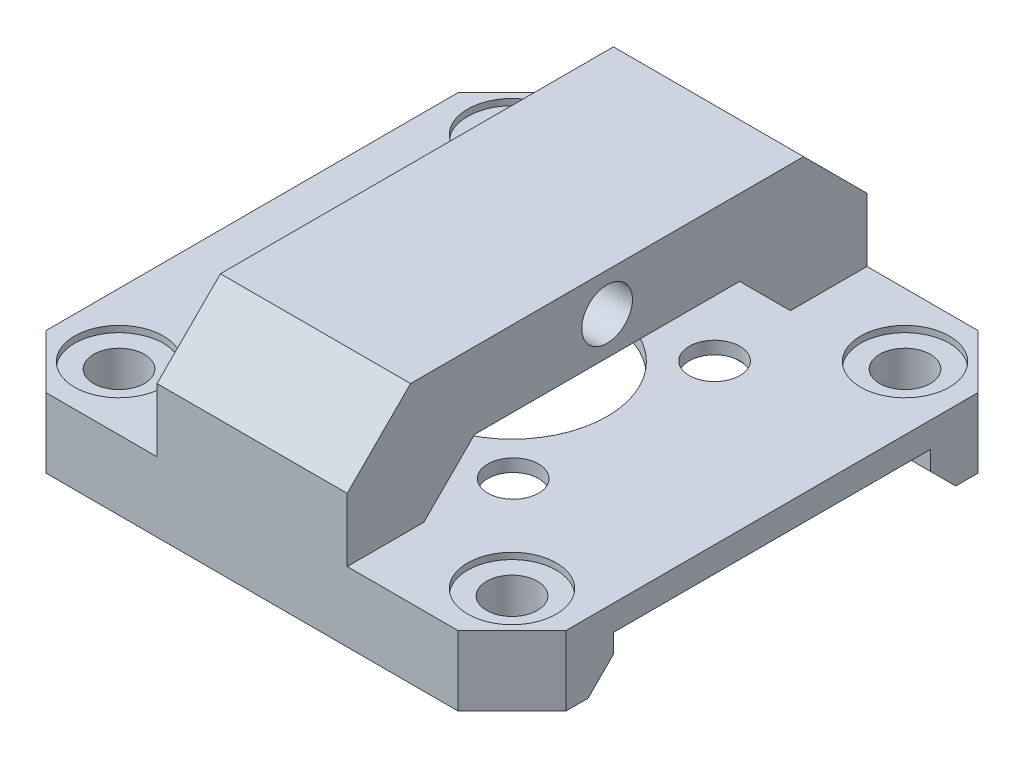
from build123d import *

# Parameters (mm, degrees)
SKETCH2_W           = 41
SKETCH2_H           = 41
BOSS_EXTRUDE1_DEPTH = 2
SKETCH3_R           = 2
CUT_EXTRUDE1_DEPTH  = 30.060282173
SKETCH4_R           = 7.5
CUT_EXTRUDE2_DEPTH  = 30.060282173
SKETCH5_W           = 25
SKETCH5_H           = 25
CUT_EXTRUDE3_DEPTH  = 1
CUT_EXTRUDE4_DEPTH  = 30.060282173
SKETCH7_R           = 2
CUT_EXTRUDE5_DEPTH  = 30.060282173
SKETCH8_W           = 25
SKETCH8_H           = 8
SKETCH8_H_2         = 7.957817611
BOSS_EXTRUDE2_DEPTH = 3.5
SKETCH9_R           = 2
CUT_EXTRUDE6_DEPTH  = 30.508473359
BOSS_EXTRUDE3_START = 3.5
SKETCH10_R          = 2
BOSS_EXTRUDE3_DEPTH = 3.5
SKETCH11_R          = 3.5
CUT_EXTRUDE7_DEPTH  = 3.5
SKETCH12_W          = 8
SKETCH12_H          = 2
BOSS_EXTRUDE4_DEPTH = 3.5
SKETCH13_R          = 3.5
CUT_EXTRUDE8_DEPTH  = 3.5
SKETCH14_R          = 3.5
SKETCH14_R_2        = 2
BOSS_EXTRUDE5_DEPTH = 3
SKETCH15_W          = 15
SKETCH15_H          = 8.042182389
SKETCH15_R          = 2
SKETCH15_H_2        = 8
BOSS_EXTRUDE6_DEPTH = 4
SKETCH16_W          = 8
SKETCH16_H          = 25
CUT_EXTRUDE9_DEPTH  = 3.5
CHAMFER3_SIZE       = 2
CHAMFER4_SIZE       = 2
SKETCH17_R          = 2
BOSS_EXTRUDE7_DEPTH = 9.5
SKETCH21_W          = 15
SKETCH21_H          = 30.915635222
CUT_EXTRUDE11_DEPTH = 4
SKETCH18_W          = 15
SKETCH18_H          = 41
BOSS_EXTRUDE8_DEPTH = 6
CHAMFER5_SIZE       = 5
SKETCH22_R          = 2
CUT_EXTRUDE12_DEPTH = 4


with BuildPart() as part:
    # Sketch2 → Boss-Extrude1 (new body)
    with BuildSketch(Plane(origin=(0, 0, 0), x_dir=(1, 0, 0), z_dir=(0, 1, 0))):
        Rectangle(SKETCH2_W, SKETCH2_H)
    extrude(amount=BOSS_EXTRUDE1_DEPTH)

    # Sketch3 → Cut-Extrude1 (cut, through all)
    with BuildSketch(Plane.XZ):
        with Locations(Location((-7.943181907, 8.037155044, 0), (0, 0, 270))):
            Circle(SKETCH3_R)
        with Locations(Location((8.037155044, 7.943181907, 0), (0, 0, 270))):
            Circle(SKETCH3_R)
        with Locations(Location((7.943181907, -8.037155044, 0), (0, 0, 270))):
            Circle(SKETCH3_R)
        with Locations(Location((-8.037155044, -7.943181907, 0), (0, 0, 270))):
            Circle(SKETCH3_R)
    extrude(amount=-CUT_EXTRUDE1_DEPTH, mode=Mode.SUBTRACT)

    # Sketch4 → Cut-Extrude2 (cut, through all)
    with BuildSketch(Plane(origin=(0, 2, 0), x_dir=(1, 0, 0), z_dir=(0, 1, 0))):
        with Locations(Location((0, 0, 0), (0, 0, 270))):
            Circle(SKETCH4_R)
    extrude(amount=-CUT_EXTRUDE2_DEPTH, mode=Mode.SUBTRACT)

    # Sketch5 → Cut-Extrude3 (cut)
    with BuildSketch(Plane.XZ):
        Rectangle(SKETCH5_W, SKETCH5_H)
    extrude(amount=-CUT_EXTRUDE3_DEPTH, mode=Mode.SUBTRACT)

    # Sketch6 → Cut-Extrude4 (cut, through all)
    with BuildSketch(Plane(origin=(0, 2, 0), x_dir=(1, 0, 0), z_dir=(0, 1, 0))):
        Polygon((-20.5, 16.257359313), (-16.257359313, 20.5), (-20.5, 20.5), align=None)
        Polygon((16.257359313, 20.5), (20.5, 16.257359313), (20.5, 20.5), align=None)
        Polygon((20.5, -16.257359313), (16.257359313, -20.5), (20.5, -20.5), align=None)
        Polygon((-16.257359313, -20.5), (-20.5, -16.257359313), (-20.5, -20.5), align=None)
    extrude(amount=-CUT_EXTRUDE4_DEPTH, mode=Mode.SUBTRACT)

    # Sketch7 → Cut-Extrude5 (cut, through all)
    with BuildSketch(Plane.XZ):
        with Locations(Location((-15.5, 15.5, 0), (0, 0, 270))):
            Circle(SKETCH7_R)
        with Locations(Location((15.5, 15.5, 0), (0, 0, 270))):
            Circle(SKETCH7_R)
        with Locations(Location((15.5, -15.5, 0), (0, 0, 270))):
            Circle(SKETCH7_R)
        with Locations(Location((-15.5, -15.5, 0), (0, 0, 270))):
            Circle(SKETCH7_R)
    extrude(amount=-CUT_EXTRUDE5_DEPTH, mode=Mode.SUBTRACT)

    # Sketch8 → Boss-Extrude2 (add)
    with BuildSketch(Plane.XZ):
        with Locations((0, 16.5)):
            Rectangle(SKETCH8_W, SKETCH8_H)
        with Locations((0, -16.478908806)):
            Rectangle(SKETCH8_W, SKETCH8_H_2)
    extrude(amount=BOSS_EXTRUDE2_DEPTH)

    # Sketch9 → Cut-Extrude6 (cut, through all)
    with BuildSketch(Plane.XZ.offset(3.5)):
        with Locations(Location((0, 16.5, 0), (0, 0, 270))):
            Circle(SKETCH9_R)
        with Locations(Location((0, -16.478908806, 0), (0, 0, 270))):
            Circle(SKETCH9_R)
    extrude(amount=-CUT_EXTRUDE6_DEPTH, mode=Mode.SUBTRACT)

    # Sketch10 → Boss-Extrude3 (add)
    # profile 1 of 3: a face of its own
    with BuildSketch(Plane.XZ.offset(BOSS_EXTRUDE3_START)):
        Polygon((-20.5, 16.257359313), (-20.5, 12.5), (-12.5, 12.5), (-12.5, 20.5), (-16.257359313, 20.5), align=None)
        with Locations(Location((-15.5, 15.5, 0), (0, 0, 270))):
            Circle(SKETCH10_R, mode=Mode.SUBTRACT)
    # profile 2 of 3: a face of its own
    with BuildSketch(Plane.XZ.offset(BOSS_EXTRUDE3_START)):
        Polygon((12.5, 12.5), (20.5, 12.5), (20.5, 16.257359313), (16.257359313, 20.5), (12.5, 20.5), align=None)
        with Locations(Location((15.5, 15.5, 0), (0, 0, 270))):
            Circle(SKETCH10_R, mode=Mode.SUBTRACT)
    # profile 3 of 3: a face of its own
    with BuildSketch(Plane.XZ.offset(BOSS_EXTRUDE3_START)):
        Polygon((-20.5, -12.5), (-20.5, -16.257359313), (-16.257359313, -20.5), (16.257359313, -20.5), (20.5, -16.257359313), (20.5, -12.5), (12.5, -12.5), (12.5, -20.457817611), (-12.5, -20.457817611), (-12.5, -12.5), align=None)
        with Locations(Location((-15.5, -15.5, 0), (0, 0, 270))):
            Circle(SKETCH10_R, mode=Mode.SUBTRACT)
        with Locations(Location((15.5, -15.5, 0), (0, 0, 270))):
            Circle(SKETCH10_R, mode=Mode.SUBTRACT)
    extrude(amount=-BOSS_EXTRUDE3_DEPTH)

    # Sketch11 → Cut-Extrude7 (cut)
    with BuildSketch(Plane(origin=(0, 2, 0), x_dir=(1, 0, 0), z_dir=(0, 1, 0))):
        with Locations(Location((-15.5, 15.5, 0), (0, 0, 270))):
            Circle(SKETCH11_R)
        with Locations(Location((15.5, 15.5, 0), (0, 0, 270))):
            Circle(SKETCH11_R)
        with Locations(Location((15.5, -15.5, 0), (0, 0, 270))):
            Circle(SKETCH11_R)
        with Locations(Location((-15.5, -15.5, 0), (0, 0, 270))):
            Circle(SKETCH11_R)
    extrude(amount=-CUT_EXTRUDE7_DEPTH, mode=Mode.SUBTRACT)

    # Sketch12 → Boss-Extrude4 (add)
    with BuildSketch(Plane.XZ):
        with Locations((-16.5, -11.5)):
            Rectangle(SKETCH12_W, SKETCH12_H)
        with Locations((-16.5, 11.5)):
            Rectangle(SKETCH12_W, SKETCH12_H)
        with Locations((16.5, -11.5)):
            Rectangle(SKETCH12_W, SKETCH12_H)
        with Locations((16.5, 11.5)):
            Rectangle(SKETCH12_W, SKETCH12_H)
    extrude(amount=BOSS_EXTRUDE4_DEPTH)

    # Sketch13 → Cut-Extrude8 (cut)
    with BuildSketch(Plane(origin=(0, 2, 0), x_dir=(1, 0, 0), z_dir=(0, 1, 0))):
        with Locations(Location((-15.5, 15.5, 0), (0, 0, 270))):
            Circle(SKETCH13_R)
        with Locations(Location((15.5, 15.5, 0), (0, 0, 270))):
            Circle(SKETCH13_R)
        with Locations(Location((15.5, -15.5, 0), (0, 0, 270))):
            Circle(SKETCH13_R)
        with Locations(Location((-15.5, -15.5, 0), (0, 0, 270))):
            Circle(SKETCH13_R)
    extrude(amount=-CUT_EXTRUDE8_DEPTH, mode=Mode.SUBTRACT)

    # Sketch14 → Boss-Extrude5 (add)
    # profile 1 of 4: a face of its own
    with BuildSketch(Plane(origin=(0, -1.5, 0), x_dir=(1, 0, 0), z_dir=(0, 1, 0))):
        with Locations(Location((-15.5, -15.5, 0), (0, 0, 270))):
            Circle(SKETCH14_R)
        with Locations(Location((-15.5, -15.5, 0), (0, 0, 90))):
            Circle(SKETCH14_R_2, mode=Mode.SUBTRACT)
    # profile 2 of 4: a face of its own
    with BuildSketch(Plane(origin=(0, -1.5, 0), x_dir=(1, 0, 0), z_dir=(0, 1, 0))):
        with Locations(Location((-15.5, 15.5, 0), (0, 0, 270))):
            Circle(SKETCH14_R)
        with Locations(Location((-15.5, 15.5, 0), (0, 0, 90))):
            Circle(SKETCH14_R_2, mode=Mode.SUBTRACT)
    # profile 3 of 4: a face of its own
    with BuildSketch(Plane(origin=(0, -1.5, 0), x_dir=(1, 0, 0), z_dir=(0, 1, 0))):
        with Locations(Location((15.5, 15.5, 0), (0, 0, 270))):
            Circle(SKETCH14_R)
        with Locations(Location((15.5, 15.5, 0), (0, 0, 90))):
            Circle(SKETCH14_R_2, mode=Mode.SUBTRACT)
    # profile 4 of 4: a face of its own
    with BuildSketch(Plane(origin=(0, -1.5, 0), x_dir=(1, 0, 0), z_dir=(0, 1, 0))):
        with Locations(Location((15.5, -15.5, 0), (0, 0, 270))):
            Circle(SKETCH14_R)
        with Locations(Location((15.5, -15.5, 0), (0, 0, 90))):
            Circle(SKETCH14_R_2, mode=Mode.SUBTRACT)
    extrude(amount=BOSS_EXTRUDE5_DEPTH)

    # Sketch15 → Boss-Extrude6 (add)
    # profile 1 of 2: a face of its own
    with BuildSketch(Plane(origin=(0, 2, 0), x_dir=(1, 0, 0), z_dir=(0, 1, 0))):
        with Locations((0, 16.478908806)):
            Rectangle(SKETCH15_W, SKETCH15_H)
        with Locations(Location((0, 16.478908806, 0), (0, 0, 90))):
            Circle(SKETCH15_R, mode=Mode.SUBTRACT)
    # profile 2 of 2: a face of its own
    with BuildSketch(Plane(origin=(0, 2, 0), x_dir=(1, 0, 0), z_dir=(0, 1, 0))):
        with Locations((0, -16.5)):
            Rectangle(SKETCH15_W, SKETCH15_H_2)
        with Locations(Location((0, -16.478908806, 0), (0, 0, 90))):
            Circle(SKETCH15_R, mode=Mode.SUBTRACT)
    extrude(amount=BOSS_EXTRUDE6_DEPTH)

    # Sketch16 → Cut-Extrude9 (cut)
    with BuildSketch(Plane.XZ.offset(3.5)):
        with Locations((-16.5, 0)):
            Rectangle(SKETCH16_W, SKETCH16_H)
        with Locations((16.5, 0)):
            Rectangle(SKETCH16_W, SKETCH16_H)
    extrude(amount=-CUT_EXTRUDE9_DEPTH, mode=Mode.SUBTRACT)

    # Chamfer3
    # the kernel refuses this chamfer: 2 mm, written as the material it takes off along each edge
    with BuildSketch(Plane(origin=(-25.643365976, -3.5, 12.5), x_dir=(0, -0.02749587661058627, 0.9996219169112968), z_dir=(1, 0, 0))) as chamfer3_piece_1:
        Polygon((CHAMFER3_SIZE * 0.999621916911, -CHAMFER3_SIZE * 0.0274958766106), (-CHAMFER3_SIZE * 0.0274958766106, -CHAMFER3_SIZE * 0.999621916911), (0, 0), align=None)
    extrude(amount=51.286731952, mode=Mode.SUBTRACT)
    with BuildSketch(Plane(origin=(12.5, -3.5, -12.5), x_dir=(0, -0.02749587661058627, -0.9996219169112968), z_dir=(-1, 0, 0))) as chamfer3_piece_2:
        Polygon((CHAMFER3_SIZE * 0.999621916911, -CHAMFER3_SIZE * 0.0274958766106), (-CHAMFER3_SIZE * 0.0274958766106, -CHAMFER3_SIZE * 0.999621916911), (0, 0), align=None)
    extrude(amount=25, mode=Mode.SUBTRACT)
    with BuildSketch(Plane(origin=(25.643365976, -3.5, -12.5), x_dir=(0, 0.9996219169112968, 0.027495876610586487), z_dir=(-1, 0, 0))) as chamfer3_piece_3:
        Polygon((CHAMFER3_SIZE * 0.999621916911, CHAMFER3_SIZE * 0.0274958766106), (-CHAMFER3_SIZE * 0.0274958766106, CHAMFER3_SIZE * 0.999621916911), (0, 0), align=None)
    extrude(amount=13.143365976, mode=Mode.SUBTRACT)
    with BuildSketch(Plane(origin=(-12.5, -3.5, -12.5), x_dir=(0, -0.02749587661058627, -0.9996219169112968), z_dir=(-1, 0, 0))) as chamfer3_piece_4:
        Polygon((CHAMFER3_SIZE * 0.999621916911, -CHAMFER3_SIZE * 0.0274958766106), (-CHAMFER3_SIZE * 0.0274958766106, -CHAMFER3_SIZE * 0.999621916911), (0, 0), align=None)
    extrude(amount=13.143365976, mode=Mode.SUBTRACT)

    # Chamfer4
    # the kernel refuses this chamfer: 2 mm, written as the material it takes off along each edge
    with BuildSketch(Plane(origin=(12.5, 0, -10.5), x_dir=(0.9996219169112968, -0.027495876610586365, 0), z_dir=(0, 0, 1))) as chamfer4_piece_1_section:
        Polygon((CHAMFER4_SIZE * 0.999621916911, CHAMFER4_SIZE * 0.0274958766106), (-CHAMFER4_SIZE * 0.0274958766106, CHAMFER4_SIZE * 0.999621916911), (0, 0), align=None)
    chamfer4_piece_1 = extrude(amount=21, mode=Mode.PRIVATE)
    chamfer4_piece_1 = split(chamfer4_piece_1, bisect_by=Plane(origin=(13.277777778, 1, 0), z_dir=(0, -1, 0)), keep=Keep.TOP, mode=Mode.PRIVATE)
    add(chamfer4_piece_1, mode=Mode.SUBTRACT)
    with BuildSketch(Plane(origin=(-12.5, 0, 10.5), x_dir=(-0.9996219169112968, -0.027495876610586365, 0), z_dir=(0, 0, -1))) as chamfer4_piece_2_section:
        Polygon((CHAMFER4_SIZE * 0.999621916911, CHAMFER4_SIZE * 0.0274958766106), (-CHAMFER4_SIZE * 0.0274958766106, CHAMFER4_SIZE * 0.999621916911), (0, 0), align=None)
    chamfer4_piece_2 = extrude(amount=21, mode=Mode.PRIVATE)
    chamfer4_piece_2 = split(chamfer4_piece_2, bisect_by=Plane(origin=(-13.277777778, 1, 0), z_dir=(0, -1, 0)), keep=Keep.TOP, mode=Mode.PRIVATE)
    add(chamfer4_piece_2, mode=Mode.SUBTRACT)
    with BuildSketch(Plane(origin=(-12.5, 0, 12.5), x_dir=(-0.9996219169112968, -0.027495876610586365, 0), z_dir=(0, 0, -1))) as chamfer4_piece_3_section:
        Polygon((CHAMFER4_SIZE * 0.999621916911, CHAMFER4_SIZE * 0.0274958766106), (-CHAMFER4_SIZE * 0.0274958766106, CHAMFER4_SIZE * 0.999621916911), (0, 0), align=None)
    chamfer4_piece_3 = extrude(amount=2, mode=Mode.PRIVATE)
    chamfer4_piece_3 = split(chamfer4_piece_3, bisect_by=Plane(origin=(-14.086266388, 1, 12.40211723), z_dir=(0, -1, 0)), keep=Keep.TOP, mode=Mode.PRIVATE)
    add(chamfer4_piece_3, mode=Mode.SUBTRACT)
    with BuildSketch(Plane(origin=(-12.5, 0, -10.5), x_dir=(-0.9996219169112968, -0.027495876610586365, 0), z_dir=(0, 0, -1))) as chamfer4_piece_4_section:
        Polygon((CHAMFER4_SIZE * 0.999621916911, CHAMFER4_SIZE * 0.0274958766106), (-CHAMFER4_SIZE * 0.0274958766106, CHAMFER4_SIZE * 0.999621916911), (0, 0), align=None)
    chamfer4_piece_4 = extrude(amount=2, mode=Mode.PRIVATE)
    chamfer4_piece_4 = split(chamfer4_piece_4, bisect_by=Plane(origin=(-13.265579252, 1, -11.486388799), z_dir=(0, -1, 0)), keep=Keep.TOP, mode=Mode.PRIVATE)
    add(chamfer4_piece_4, mode=Mode.SUBTRACT)
    with BuildSketch(Plane(origin=(12.5, 0, -12.5), x_dir=(0.9996219169112968, -0.02749587661058633, 0), z_dir=(0, 0, 1))) as chamfer4_piece_5_section:
        Polygon((CHAMFER4_SIZE * 0.999621916911, CHAMFER4_SIZE * 0.0274958766106), (-CHAMFER4_SIZE * 0.0274958766106, CHAMFER4_SIZE * 0.999621916911), (0, 0), align=None)
    chamfer4_piece_5 = extrude(amount=2, mode=Mode.PRIVATE)
    chamfer4_piece_5 = split(chamfer4_piece_5, bisect_by=Plane(origin=(14.086266388, 1, -12.40211723), z_dir=(0, -1, 0)), keep=Keep.TOP, mode=Mode.PRIVATE)
    add(chamfer4_piece_5, mode=Mode.SUBTRACT)
    with BuildSketch(Plane(origin=(12.5, 0, 10.5), x_dir=(0.9996219169112968, -0.027495876610586344, 0), z_dir=(0, 0, 1))) as chamfer4_piece_6_section:
        Polygon((CHAMFER4_SIZE * 0.999621916911, CHAMFER4_SIZE * 0.0274958766106), (-CHAMFER4_SIZE * 0.0274958766106, CHAMFER4_SIZE * 0.999621916911), (0, 0), align=None)
    chamfer4_piece_6 = extrude(amount=2, mode=Mode.PRIVATE)
    chamfer4_piece_6 = split(chamfer4_piece_6, bisect_by=Plane(origin=(13.265579252, 1, 11.486388799), z_dir=(0, -1, 0)), keep=Keep.TOP, mode=Mode.PRIVATE)
    add(chamfer4_piece_6, mode=Mode.SUBTRACT)

    # Sketch17 → Boss-Extrude7 (add, through all)
    with BuildSketch(Plane(origin=(0, 6, 0), x_dir=(1, 0, 0), z_dir=(0, 1, 0))):
        with Locations((0, 16.478908806)):
            Circle(SKETCH17_R)
        with Locations((0, -16.478908806)):
            Circle(SKETCH17_R)
    extrude(amount=-BOSS_EXTRUDE7_DEPTH)

    # Sketch21 → Cut-Extrude11 (cut)
    with BuildSketch(Plane(origin=(0, 6, 0), x_dir=(1, 0, 0), z_dir=(0, 1, 0))):
        Rectangle(SKETCH21_W, SKETCH21_H)
    extrude(amount=-CUT_EXTRUDE11_DEPTH, mode=Mode.SUBTRACT)

    # Sketch18 → Boss-Extrude8 (add)
    with BuildSketch(Plane(origin=(0, 6, 0), x_dir=(1, 0, 0), z_dir=(0, 1, 0))):
        Rectangle(SKETCH18_W, SKETCH18_H)
    extrude(amount=BOSS_EXTRUDE8_DEPTH)

    # Chamfer5
    # the kernel refuses this chamfer: 5 mm, written as the material it adds along each edge
    with BuildSketch(Plane(origin=(-7.5, 6, 15.457817611), x_dir=(0, -0.9996219169112968, 0.027495876610586317), z_dir=(1, 0, 0))) as chamfer5_piece_1:
        Polygon((CHAMFER5_SIZE * 0.999621916911, CHAMFER5_SIZE * 0.0274958766106), (-CHAMFER5_SIZE * 0.0274958766106, CHAMFER5_SIZE * 0.999621916911), (0, 0), align=None)
    extrude(amount=15)
    with BuildSketch(Plane(origin=(7.5, 6, -15.457817611), x_dir=(0, 0.027495876610586317, 0.9996219169112968), z_dir=(-1, 0, 0))) as chamfer5_piece_2:
        Polygon((CHAMFER5_SIZE * 0.999621916911, -CHAMFER5_SIZE * 0.0274958766106), (-CHAMFER5_SIZE * 0.0274958766106, -CHAMFER5_SIZE * 0.999621916911), (0, 0), align=None)
    extrude(amount=15)
    # the kernel refuses this chamfer: 5 mm, written as the material it takes off along each edge
    with BuildSketch(Plane(origin=(20.35841494, 12, -20.5), x_dir=(0, -0.9996219169112968, -0.027495876610586317), z_dir=(-1, 0, 0)), Plane(origin=(-20.35841494, 12, 20.5), x_dir=(0, -0.9996219169112968, 0.027495876610586317), z_dir=(1, 0, 0))) as chamfer5_2_piece_1:
        Polygon((CHAMFER5_SIZE * 0.999621916911, CHAMFER5_SIZE * 0.0274958766106), (-CHAMFER5_SIZE * 0.0274958766106, CHAMFER5_SIZE * 0.999621916911), (0, 0), align=None)
    extrude(amount=40.71682988, mode=Mode.SUBTRACT)

    # Sketch22 → Cut-Extrude12 (cut)
    with BuildSketch(Plane(origin=(7.5, 0, 0), x_dir=(0, 0, -1), z_dir=(1, 0, 0))):
        with Locations((0, 9)):
            Circle(SKETCH22_R)
    cut_extrude12 = extrude(amount=-CUT_EXTRUDE12_DEPTH, mode=Mode.SUBTRACT)

    # Mirror1: Cut-Extrude12 across plane
    add(cut_extrude12.mirror(Plane(origin=(0, 0, 0), x_dir=(0, 0, 1), z_dir=(1, 0, 0))), mode=Mode.SUBTRACT)


solid = part.part
